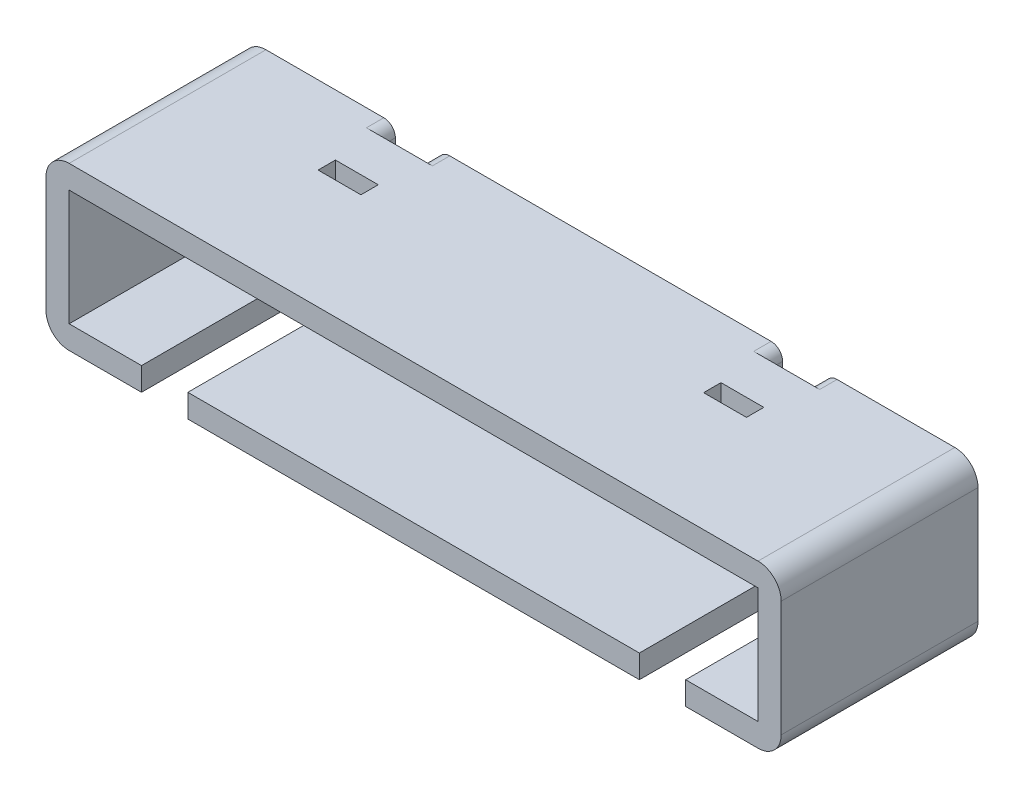
from build123d import *

# Parameters (mm, degrees)
SKETCH1_W              = 2
SKETCH1_H              = 2
SKETCH1_H_2            = 10
SKETCH1_W_2            = 59.5
BOSS_EXTRUDE1_DEPTH    = 15
SKETCH1_5_W            = 59.5
SKETCH1_5_H            = 10
SKETCH1_5_R            = 1.75
SKETCH1_5_H_2          = 2
SKETCH1_5_W_2          = 2
BOSS_EXTRUDE2_DEPTH    = 2
SKETCH2_W              = 4
SKETCH2_H              = 2
CUT_EXTRUDE1_DEPTH     = 15
CUT_EXTRUDE2_START     = -14
CUT_EXTRUDE2_OUTLINE_W = 3.7
CUT_EXTRUDE2_OUTLINE_H = 1.5
CUT_EXTRUDE2_DEPTH     = 14
CUT_EXTRUDE3_DEPTH     = 1.5
FILLET1_R              = 2
FILLET2_R              = 1
SKETCH11_W             = 3.7
SKETCH11_H             = 14
BOSS_EXTRUDE4_DEPTH    = 1.5


# Read off the part's stored shape, not the designer's step: Cut-Extrude2
with BuildPart() as part:
    # Sketch1 → Boss-Extrude1 (new body)
    with BuildSketch(Plane.XY):
        with Locations((55.75, 6)):
            Rectangle(SKETCH1_W, SKETCH1_H)
        with Locations((55.75, 0)):
            Rectangle(SKETCH1_W, SKETCH1_H_2)
        with Locations((-5.75, 0)):
            Rectangle(SKETCH1_W, SKETCH1_H_2)
        with Locations((-5.75, 6)):
            Rectangle(SKETCH1_W, SKETCH1_H)
        with Locations((25, 6)):
            Rectangle(SKETCH1_W_2, SKETCH1_H)
        with Locations((-5.75, -6)):
            Rectangle(SKETCH1_W, SKETCH1_H)
        with Locations((25, -6)):
            Rectangle(SKETCH1_W_2, SKETCH1_H)
        with Locations((55.75, -6)):
            Rectangle(SKETCH1_W, SKETCH1_H)
    extrude(amount=BOSS_EXTRUDE1_DEPTH)

    # Sketch1<5> → Boss-Extrude2 (add)
    # profile 1 of 9: a face of its own
    with BuildSketch(Plane.XY):
        with Locations((25, 0)):
            Rectangle(SKETCH1_5_W, SKETCH1_5_H)
        Circle(SKETCH1_5_R, mode=Mode.SUBTRACT)
        with Locations((50, 0)):
            Circle(SKETCH1_5_R, mode=Mode.SUBTRACT)
    # profile 2 of 9: a face of its own
    with BuildSketch(Plane.XY):
        with Locations((25, 6)):
            Rectangle(SKETCH1_5_W, SKETCH1_5_H_2)
    # profile 3 of 9: a face of its own
    with BuildSketch(Plane.XY):
        with Locations((25, -6)):
            Rectangle(SKETCH1_5_W, SKETCH1_5_H_2)
    # profile 4 of 9: a face of its own
    with BuildSketch(Plane.XY):
        with Locations((55.75, 0)):
            Rectangle(SKETCH1_5_W_2, SKETCH1_5_H)
    # profile 5 of 9: a face of its own
    with BuildSketch(Plane.XY):
        with Locations((55.75, 6)):
            Rectangle(SKETCH1_5_W_2, SKETCH1_5_H_2)
    # profile 6 of 9: a face of its own
    with BuildSketch(Plane.XY):
        with Locations((55.75, -6)):
            Rectangle(SKETCH1_5_W_2, SKETCH1_5_H_2)
    # profile 7 of 9: a face of its own
    with BuildSketch(Plane.XY):
        with Locations((-5.75, 6)):
            Rectangle(SKETCH1_5_W_2, SKETCH1_5_H_2)
    # profile 8 of 9: a face of its own
    with BuildSketch(Plane.XY):
        with Locations((-5.75, 0)):
            Rectangle(SKETCH1_5_W_2, SKETCH1_5_H)
    # profile 9 of 9: a face of its own
    with BuildSketch(Plane.XY):
        with Locations((-5.75, -6)):
            Rectangle(SKETCH1_5_W_2, SKETCH1_5_H_2)
    extrude(amount=-BOSS_EXTRUDE2_DEPTH)

    # Sketch2 → Cut-Extrude1 (cut)
    with BuildSketch(Plane.XY.offset(15)):
        with Locations((3.5, -6)):
            Rectangle(SKETCH2_W, SKETCH2_H)
        with Locations((46.5, -6)):
            Rectangle(SKETCH2_W, SKETCH2_H)
    extrude(amount=-CUT_EXTRUDE1_DEPTH, mode=Mode.SUBTRACT)

    # Cut-Extrude2 outline → Cut-Extrude2 (cut)
    with BuildSketch(Plane(origin=(0, 7, 0), x_dir=(1, 0, 0), z_dir=(0, 1, 0)).offset(CUT_EXTRUDE2_START)):
        with Locations((8.35, -4)):
            Rectangle(CUT_EXTRUDE2_OUTLINE_W, CUT_EXTRUDE2_OUTLINE_H)
        with Locations((41.65, -4)):
            Rectangle(CUT_EXTRUDE2_OUTLINE_W, CUT_EXTRUDE2_OUTLINE_H)
    extrude(amount=CUT_EXTRUDE2_DEPTH, mode=Mode.SUBTRACT)

    # Sketch4 → Cut-Extrude3 (cut)
    with BuildSketch(Plane(origin=(0, 0, -2), x_dir=(-1, 0, 0), z_dir=(0, 0, -1))):
        Polygon((-10.125, 7), (-10.125, 5), (-10.125, -5), (-10.125, -7), (-6.425, -7), (-6.425, 7), align=None)
        Polygon((-39.875, 5), (-39.875, 7), (-43.575, 7), (-43.575, -7), (-39.875, -7), (-39.875, -5), align=None)
    extrude(amount=-CUT_EXTRUDE3_DEPTH, mode=Mode.SUBTRACT)

    # Fillet1
    fillet1_edges = [part.edges().sort_by_distance(p)[0] for p in [
        (-6.75, 7, 6.5),
        (56.75, 7, 6.5),
        (56.75, -7, 6.5),
        (-6.75, -7, 6.5),
    ]]
    fillet(fillet1_edges, radius=FILLET1_R)

    # Fillet2
    fillet2_edges = [part.edges().sort_by_distance(p)[0] for p in [
        (10.125, -7, -1.25),
        (10.125, 7, -1.25),
        (6.425, 7, -1.25),
        (6.425, -7, -1.25),
        (39.875, 7, -1.25),
        (39.875, -7, -1.25),
        (43.575, -7, -1.25),
        (43.575, 7, -1.25),
        (1.5, -6, 0),
        (5.5, -6, 0),
        (48.5, -6, 0),
        (44.5, -6, 0),
    ]]
    fillet(fillet2_edges, radius=FILLET2_R)

    # Sketch11 → Boss-Extrude4 (add)
    with BuildSketch(Plane(origin=(0, 0, -0.5), x_dir=(-1, 0, 0), z_dir=(0, 0, -1))):
        with Locations((-41.725, 0)):
            Rectangle(SKETCH11_W, SKETCH11_H)
        with Locations((-8.275, 0)):
            Rectangle(SKETCH11_W, SKETCH11_H)
    extrude(amount=-BOSS_EXTRUDE4_DEPTH)


solid = part.part
